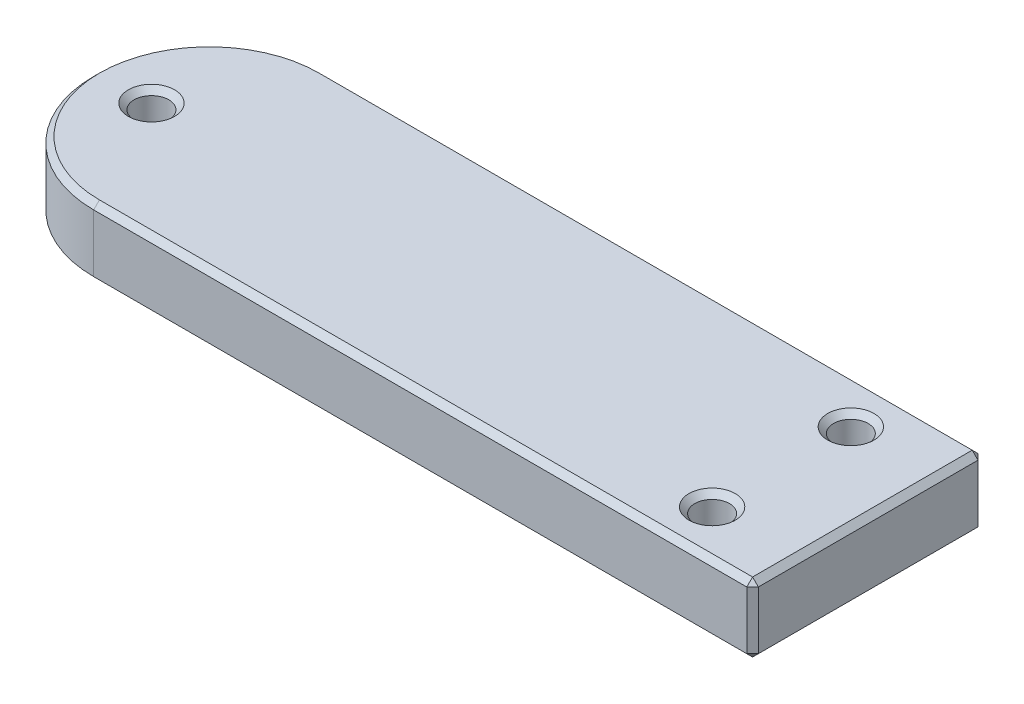
from build123d import *

# Parameters (mm, degrees)
CROQUIS1_W              = 67
CROQUIS1_H              = 20
CROQUIS1_R              = 1.5
SALIENTE_EXTRUIR1_DEPTH = 6
REDONDEO1_R             = 10
CHAFL_N2_SIZE           = 0.5


with BuildPart() as part:
    # Croquis1 → Saliente-Extruir1 (new body)
    with BuildSketch(Plane(origin=(0, 0, 0), x_dir=(1, 0, 0), z_dir=(0, 1, 0))):
        with Locations((28.5, 0)):
            Rectangle(CROQUIS1_W, CROQUIS1_H)
        with Locations(Location((0, 0, 0), (0, 0, 270))):
            Circle(CROQUIS1_R, mode=Mode.SUBTRACT)
        with Locations(Location((54.5, 6, 0), (0, 0, 270))):
            Circle(CROQUIS1_R, mode=Mode.SUBTRACT)
        with Locations(Location((54.5, -6, 0), (0, 0, 270))):
            Circle(CROQUIS1_R, mode=Mode.SUBTRACT)
    extrude(amount=SALIENTE_EXTRUIR1_DEPTH)

    # Redondeo1
    redondeo1_edges = [part.edges().sort_by_distance(p)[0] for p in [
        (-5, 3, -10),
        (-5, 3, 10),
    ]]
    fillet(redondeo1_edges, radius=REDONDEO1_R - 0.0001)  # a hair under: the kernel refuses the full size

    # Chaflán2
    chafl_n2_edges = [part.edges().sort_by_distance(p)[0] for p in [
        (0, 0, -1.5),
        (0, 6, -1.5),
        (54.5, 0, -7.5),
        (54.5, 6, -7.5),
        (54.5, 0, 4.5),
        (54.5, 6, 4.5),
        (33.49995, 0, 10),
        (-2.071097101, 0, 7.071097101),
        (-2.071097101, 0, -7.071097101),
        (33.49995, 6, 10),
        (-2.071097101, 6, 7.071097101),
        (-2.071097101, 6, -7.071097101),
        (62, 6, 0),
        (33.49995, 0, -10),
        (62, 0, 0),
        (33.49995, 6, -10),
        (62, 3, 10),
        (62, 3, -10),
    ]]
    chamfer(chafl_n2_edges, length=CHAFL_N2_SIZE)


solid = part.part
